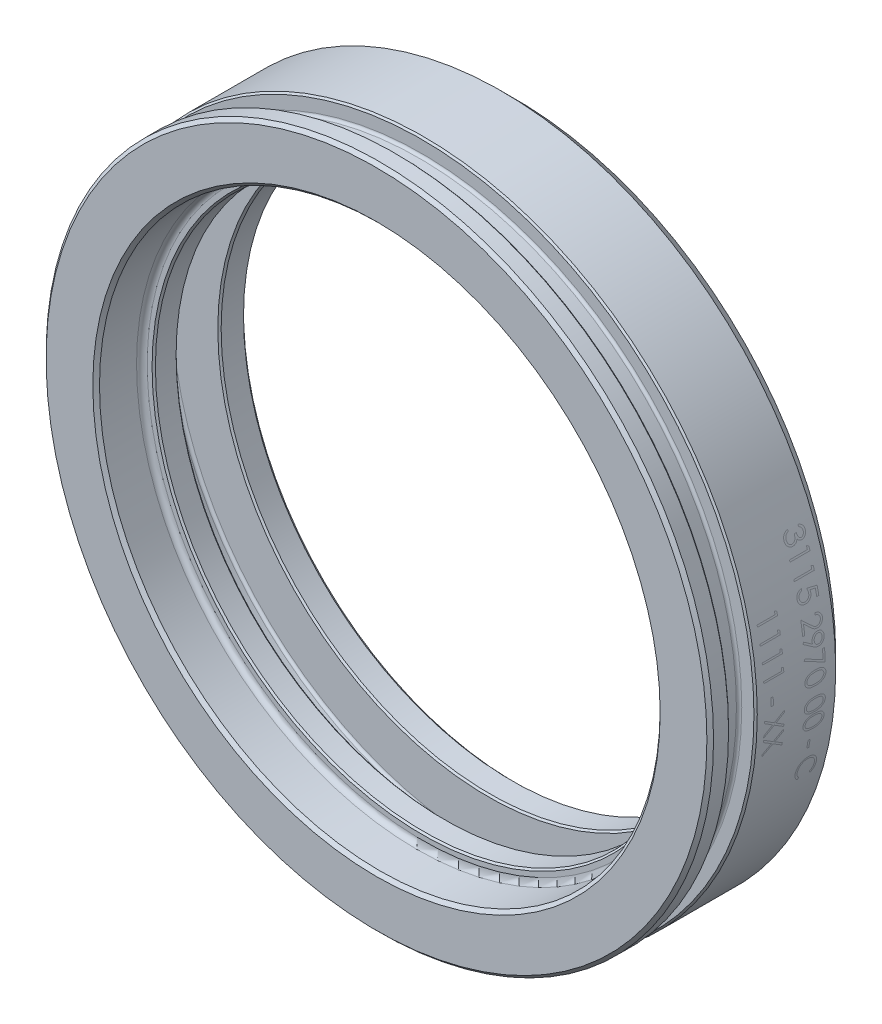
from build123d import *


with BuildPart() as part:
    # Sketch1 → Revolve1 (revolve)
    with BuildSketch(Plane(origin=(0, 0, 0), x_dir=(0, 0, -1), z_dir=(1, 0, 0))):
        with BuildLine():
            Line((0, 49.5), (0, 42.5))
            Line((0, 42.5), (0.5, 42))
            Line((0.5, 42), (6.05, 42))
            ThreePointArc((6.05, 42), (6.615685425, 41.765685425), (6.85, 41.2))
            Line((6.85, 41.2), (6.85, 40.475))
            Line((6.85, 40.475), (7.1, 40.225))
            Line((7.1, 40.225), (10.2, 40.225))
            Line((10.2, 40.225), (10.45, 40.475))
            Line((10.45, 40.475), (10.45, 47.35))
            ThreePointArc((10.45, 47.35), (10.567157288, 47.632842712), (10.85, 47.75))
            Line((10.85, 47.75), (16.3, 47.75))
            ThreePointArc((16.3, 47.75), (16.582842712, 47.632842712), (16.7, 47.35))
            Line((16.7, 47.35), (16.7, 40.475))
            Line((16.7, 40.475), (16.95, 40.225))
            Line((16.95, 40.225), (20.3, 40.225))
            Line((20.3, 40.225), (20.8, 40.725))
            Line((20.8, 40.725), (20.8, 48))
            Line((20.8, 48), (18.8, 50))
            Line((18.8, 50), (7.05, 50))
            Line((7.05, 50), (6.8, 49.75))
            Line((6.8, 49.75), (6.8, 47.925))
            ThreePointArc((6.8, 47.925), (6.682842712, 47.642157288), (6.4, 47.525))
            Line((6.4, 47.525), (3.4, 47.525))
            ThreePointArc((3.4, 47.525), (3.117157288, 47.642157288), (3, 47.925))
            Line((3, 47.925), (3, 49.75))
            Line((3, 49.75), (2.75, 50))
            Line((2.75, 50), (0.5, 50))
            Line((0.5, 50), (0, 49.5))
        make_face()
    revolve(axis=Axis((0, 0, 12.282489529), (0, 0, -1)))


solid = part.part
